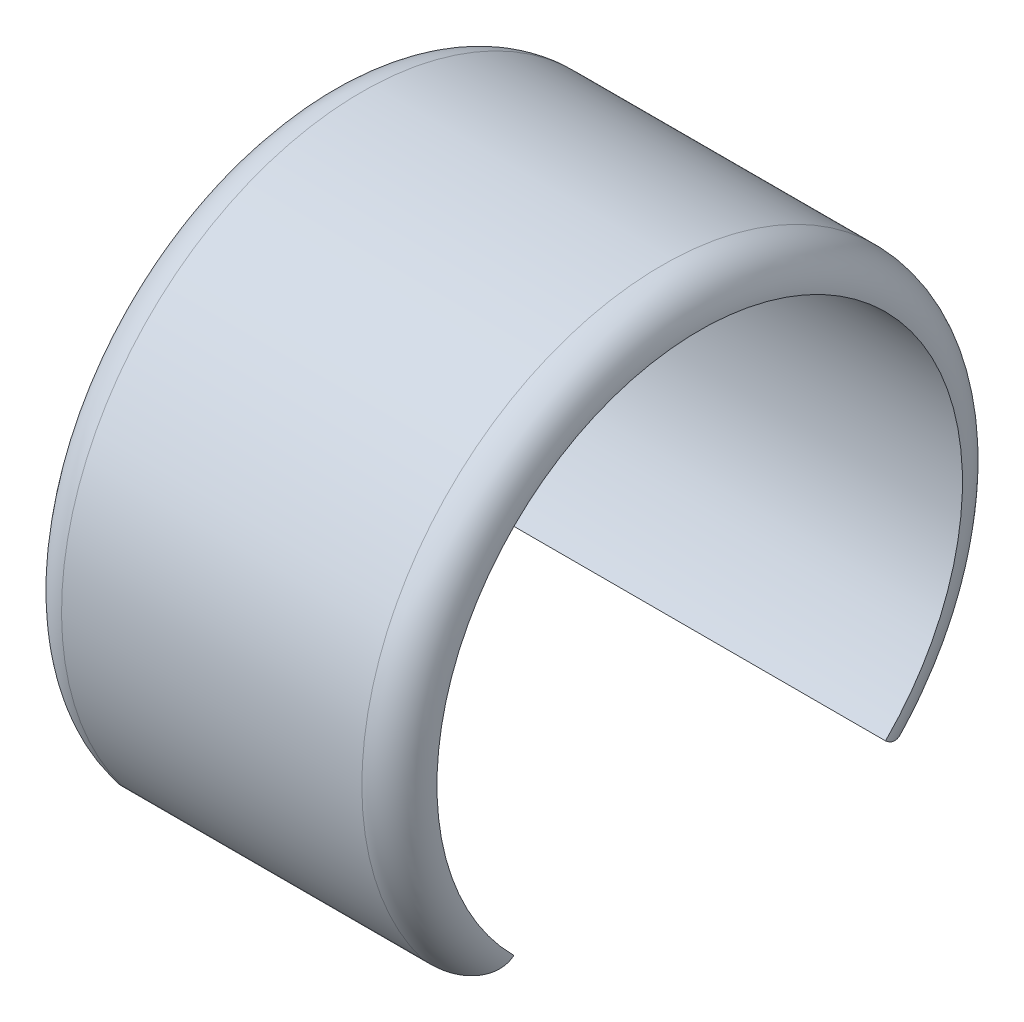
from build123d import *

# Parameters (mm, degrees)
CROQUIS1_W        = 100
CROQUIS1_H        = 10
REVOLUCI_N1_ANGLE = 270
REDONDEO1_START   = -50
REDONDEO1_DEPTH   = 100


with BuildPart() as part:
    # Croquis1 → Revolución1 (revolve, symmetric)
    with BuildSketch(Plane.XY) as revoluci_n1_sk:
        with Locations((0, 75)):
            Rectangle(CROQUIS1_W, CROQUIS1_H)
    revolve(axis=Axis((-67.260939077, 0, 0), (1, 0, 0)), revolution_arc=REVOLUCI_N1_ANGLE / 2)
    revolve(revoluci_n1_sk.sketch, axis=Axis((-67.260939077, 0, 0), (-1, 0, 0)), revolution_arc=REVOLUCI_N1_ANGLE / 2)

    # Redondeo1: read off the stored shape, not the designer's step
    # Redondeo1 outline → Redondeo1 (cut)
    with BuildSketch(Plane.YZ.offset(REDONDEO1_START)):
        with BuildLine():
            ThreePointArc((-49.497474683, 49.497474683), (-51.881951338, 57.115692474), (-47.930733833, 64.051891105))
            ThreePointArc((-47.930733833, 64.051891105), (-52.383440274, 60.46466063), (-56.568542495, 56.568542495))
            Line((-56.568542495, 56.568542495), (-49.497474683, 49.497474683))
        make_face()
        with BuildLine():
            ThreePointArc((-47.930733833, -64.051891105), (-51.881951338, -57.115692474), (-49.497474683, -49.497474683))
            Line((-49.497474683, -49.497474683), (-56.568542495, -56.568542495))
            ThreePointArc((-56.568542495, -56.568542495), (-52.383440274, -60.46466063), (-47.930733833, -64.051891105))
        make_face()
    extrude(amount=REDONDEO1_DEPTH, mode=Mode.SUBTRACT)

    # Redondeo1 2 outline → Redondeo1 2 (revolve, cut)
    with BuildSketch(Plane.YX):
        with BuildLine():
            Line((80, 50), (70, 50))
            ThreePointArc((70, 50), (77.071067812, 47.071067812), (80, 40))
            Line((80, 40), (80, 50))
        make_face()
        with BuildLine():
            Line((80, -50), (80, -40))
            ThreePointArc((80, -40), (77.071067812, -47.071067812), (70, -50))
            Line((70, -50), (80, -50))
        make_face()
    revolve(axis=Axis((0, 0, 0), (1, 0, 0)), mode=Mode.SUBTRACT)


solid = part.part
